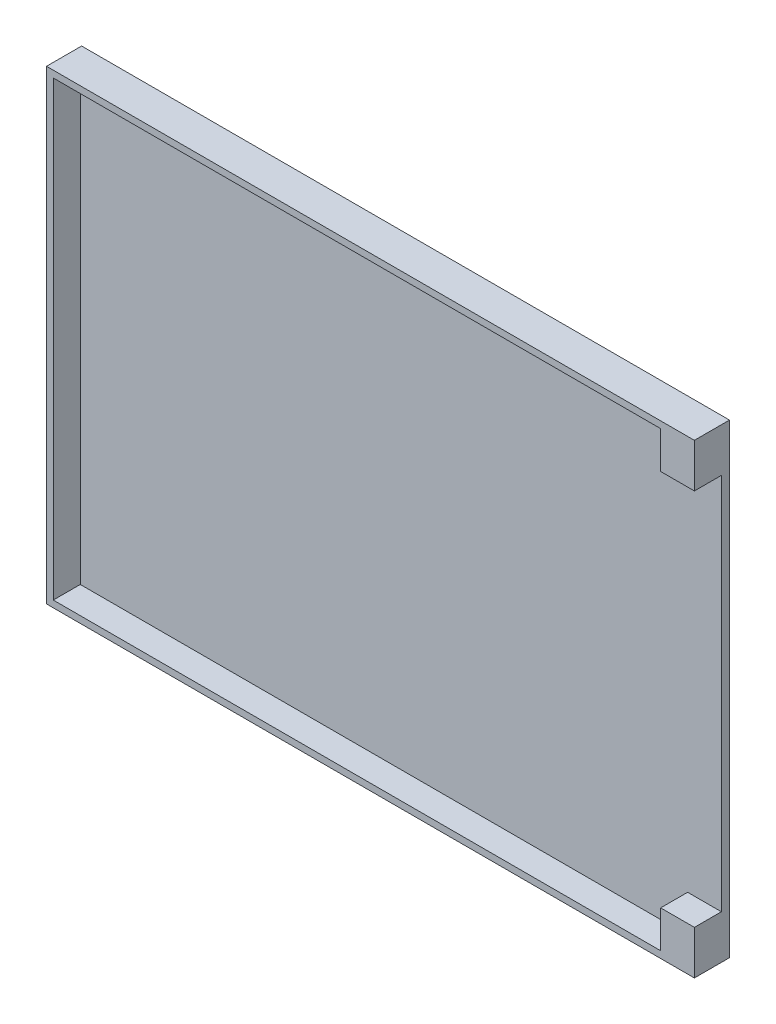
from build123d import *

# Parameters (mm, degrees)
SKETCH_1_W      = 48
SKETCH_1_H      = 34.5
EXTRUDE_1_DEPTH = 0.6
EXTRUDE_2_DEPTH = 2


with BuildPart() as part:
    # Эскиз1 → Бобышка-Вытянуть1 (new body)
    with BuildSketch(Plane.XY):
        Rectangle(SKETCH_1_W, SKETCH_1_H)
    extrude(amount=EXTRUDE_1_DEPTH)

    # Эскиз2 → Бобышка-Вытянуть2 (add)
    with BuildSketch(Plane.XY.offset(0.6)):
        Polygon((24, 17.25), (-24, 17.25), (-24, -17.25), (24, -17.25), (24, -14), (21.5, -14), (21.5, -16.75), (-23.5, -16.75), (-23.5, 16.75), (21.5, 16.75), (21.5, 14), (24, 14), align=None)
    extrude(amount=EXTRUDE_2_DEPTH)


solid = part.part
